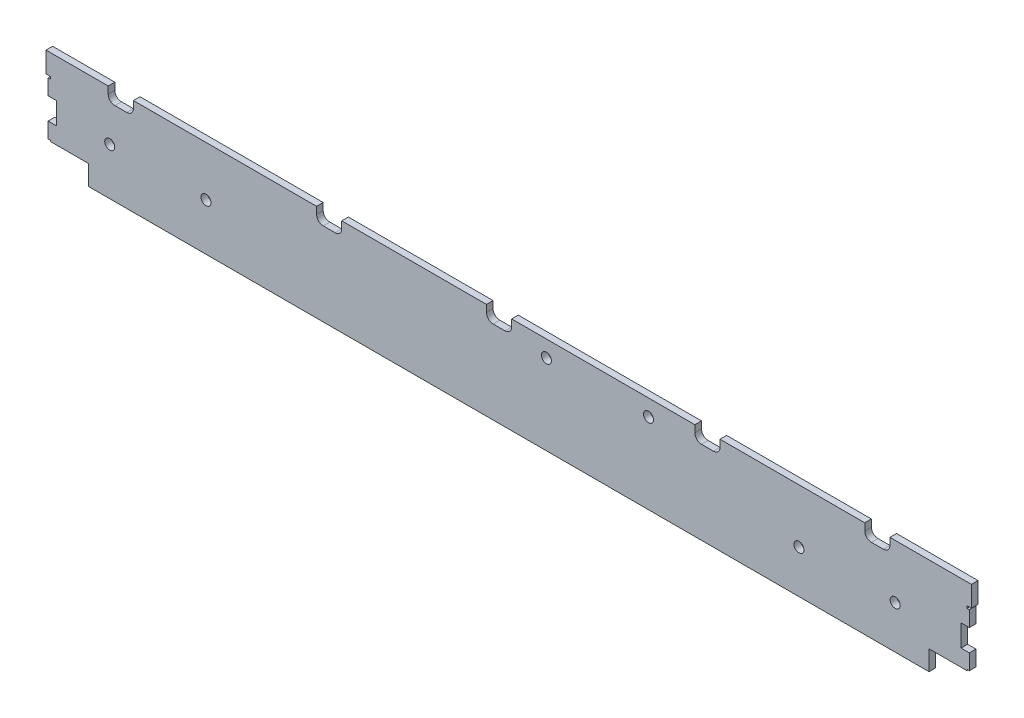
from build123d import *

# Parameters (mm, degrees)
BOSS_EXTRUDE1_DEPTH          = 3.175
M4_CLEARANCE_HOLE1_OUTLINE_R = 2.4
M4_CLEARANCE_HOLE1_DEPTH     = 3.175
CUT_EXTRUDE1_DEPTH           = 3.175


# Read off the part's stored shape, not the designer's step: M4 Clearance Hole1
with BuildPart() as part:
    # Sketch2 → Boss-Extrude1 (new body)
    with BuildSketch(Plane.XY):
        with BuildLine():
            Line((227.491320086, -163.756000107), (221.761320086, -163.756000107))
            ThreePointArc((221.761320086, -163.756000107), (219.516256056, -162.826064137), (218.586320086, -160.581000107))
            Line((218.586320086, -160.581000107), (218.586320086, -157.216000107))
            Line((218.586320086, -157.216000107), (149.097320094, -157.216000107))
            Line((149.097320094, -157.216000107), (149.097320094, -160.581000107))
            ThreePointArc((149.097320094, -160.581000107), (148.167384125, -162.826064137), (145.922320094, -163.756000107))
            Line((145.922320094, -163.756000107), (140.192320094, -163.756000107))
            ThreePointArc((140.192320094, -163.756000107), (137.947256064, -162.826064137), (137.017320094, -160.581000107))
            Line((137.017320094, -160.581000107), (137.017320094, -157.216000107))
            Line((137.017320094, -157.216000107), (49.052320094, -157.216000107))
            Line((49.052320094, -157.216000107), (49.052320094, -160.581000107))
            ThreePointArc((49.052320094, -160.581000107), (48.122384125, -162.826064137), (45.877320094, -163.756000107))
            Line((45.877320094, -163.756000107), (40.147320094, -163.756000107))
            ThreePointArc((40.147320094, -163.756000107), (37.902256064, -162.826064137), (36.972320094, -160.581000107))
            Line((36.972320094, -160.581000107), (36.972320094, -157.216000107))
            Line((36.972320094, -157.216000107), (-32.516679898, -157.216000107))
            Line((-32.516679898, -157.216000107), (-32.516679898, -160.581000107))
            ThreePointArc((-32.516679898, -160.581000107), (-33.446615867, -162.826064137), (-35.691679898, -163.756000107))
            Line((-35.691679898, -163.756000107), (-41.421679898, -163.756000107))
            ThreePointArc((-41.421679898, -163.756000107), (-43.666743928, -162.826064137), (-44.596679898, -160.581000107))
            Line((-44.596679898, -160.581000107), (-44.596679898, -157.216000107))
            Line((-44.596679898, -157.216000107), (-132.561679898, -157.216000107))
            Line((-132.561679898, -157.216000107), (-132.561679898, -160.581000107))
            ThreePointArc((-132.561679898, -160.581000107), (-133.491615867, -162.826064137), (-135.736679898, -163.756000107))
            Line((-135.736679898, -163.756000107), (-141.466679898, -163.756000107))
            ThreePointArc((-141.466679898, -163.756000107), (-143.711743928, -162.826064137), (-144.641679898, -160.581000107))
            Line((-144.641679898, -160.581000107), (-144.641679898, -157.216000107))
            Line((-144.641679898, -157.216000107), (-174.499179878, -157.216000107))
            Line((-174.499179878, -157.216000107), (-174.499179878, -167.122000107))
            Line((-174.499179878, -167.122000107), (-172.356179878, -167.122000107))
            Line((-172.356179878, -167.122000107), (-172.356179878, -168.265000107))
            Line((-172.356179878, -168.265000107), (-173.499179878, -168.265000107))
            Line((-173.499179878, -168.265000107), (-173.499179878, -193.665000107))
            Line((-173.499179878, -193.665000107), (-172.356179878, -193.665000107))
            Line((-172.356179878, -193.665000107), (-172.356179878, -194.181000107))
            Line((-172.356179878, -194.181000107), (-154.179179878, -194.181000107))
            Line((-154.179179878, -194.181000107), (-154.179179878, -203.714000107))
            Line((-154.179179878, -203.714000107), (249.446820082, -203.714000107))
            Line((249.446820082, -203.714000107), (249.446820082, -194.181000107))
            Line((249.446820082, -194.181000107), (267.623820082, -194.181000107))
            Line((267.623820082, -194.181000107), (267.623820082, -193.665000107))
            Line((267.623820082, -193.665000107), (268.766820082, -193.665000107))
            Line((268.766820082, -193.665000107), (268.766820082, -168.265000107))
            Line((268.766820082, -168.265000107), (267.623820082, -168.265000107))
            Line((267.623820082, -168.265000107), (267.623820082, -167.122000107))
            Line((267.623820082, -167.122000107), (269.766820082, -167.122000107))
            Line((269.766820082, -167.122000107), (269.766820082, -157.216000107))
            Line((269.766820082, -157.216000107), (230.666320086, -157.216000107))
            Line((230.666320086, -157.216000107), (230.666320086, -160.581000107))
            ThreePointArc((230.666320086, -160.581000107), (229.736384117, -162.826064137), (227.491320086, -163.756000107))
        make_face()
    extrude(amount=BOSS_EXTRUDE1_DEPTH)

    # M4 Clearance Hole1 outline → M4 Clearance Hole1 (cut)
    with BuildSketch(Plane.XY):
        with Locations((233.170320102, -183.106000107)):
            Circle(M4_CLEARANCE_HOLE1_OUTLINE_R)
        with Locations((186.970320102, -183.106000107)):
            Circle(M4_CLEARANCE_HOLE1_OUTLINE_R)
        with Locations((114.745320102, -165.106000107)):
            Circle(M4_CLEARANCE_HOLE1_OUTLINE_R)
        with Locations((65.745320102, -165.106000107)):
            Circle(M4_CLEARANCE_HOLE1_OUTLINE_R)
        with Locations((-97.702679898, -181.106000107)):
            Circle(M4_CLEARANCE_HOLE1_OUTLINE_R)
        with Locations((-143.902679898, -181.106000107)):
            Circle(M4_CLEARANCE_HOLE1_OUTLINE_R)
    extrude(amount=M4_CLEARANCE_HOLE1_DEPTH, mode=Mode.SUBTRACT)

    # Sketch5 → Cut-Extrude1 (cut)
    with BuildSketch(Plane.XY.offset(3.175)):
        Polygon((264.766820082, -175.717058259), (268.766820082, -175.717058259), (268.766820082, -176.460000107), (266.515167585, -176.460000107), (264.766820082, -176.928468408), align=None)
        with BuildLine():
            Line((271.531820082, -185.652747691), (271.531820082, -186.212941955))
            Line((271.531820082, -186.212941955), (268.766820082, -186.212941955))
            Line((268.766820082, -186.212941955), (268.766820082, -185.470000107))
            Line((268.766820082, -185.470000107), (266.515167585, -185.470000107))
            Line((266.515167585, -185.470000107), (264.766820082, -185.001531806))
            Line((264.766820082, -185.001531806), (264.766820082, -176.928468408))
            Line((264.766820082, -176.928468408), (266.515167585, -176.460000107))
            Line((266.515167585, -176.460000107), (268.766820082, -176.460000107))
            Line((268.766820082, -176.460000107), (268.766820082, -175.717058259))
            Line((268.766820082, -175.717058259), (271.531820082, -175.717058259))
            Line((271.531820082, -175.717058259), (271.531820082, -176.277252523))
            ThreePointArc((271.531820082, -176.277252523), (272.085217516, -176.676347658), (272.296820082, -177.325000107))
            Line((272.296820082, -177.325000107), (272.296820082, -184.605000107))
            ThreePointArc((272.296820082, -184.605000107), (272.085217516, -185.253652556), (271.531820082, -185.652747691))
        make_face()
        Polygon((264.766820082, -185.001531806), (264.766820082, -186.212941955), (268.766820082, -186.212941955), (268.766820082, -185.470000107), (266.515167585, -185.470000107), align=None)
    cut_extrude1 = extrude(amount=-CUT_EXTRUDE1_DEPTH, mode=Mode.SUBTRACT)

    # Mirror1: Cut-Extrude1 across plane
    add(cut_extrude1.mirror(Plane(origin=(47.633820102, 0, 0), x_dir=(0, 0, 1), z_dir=(1, 0, 0))), mode=Mode.SUBTRACT)


solid = part.part
